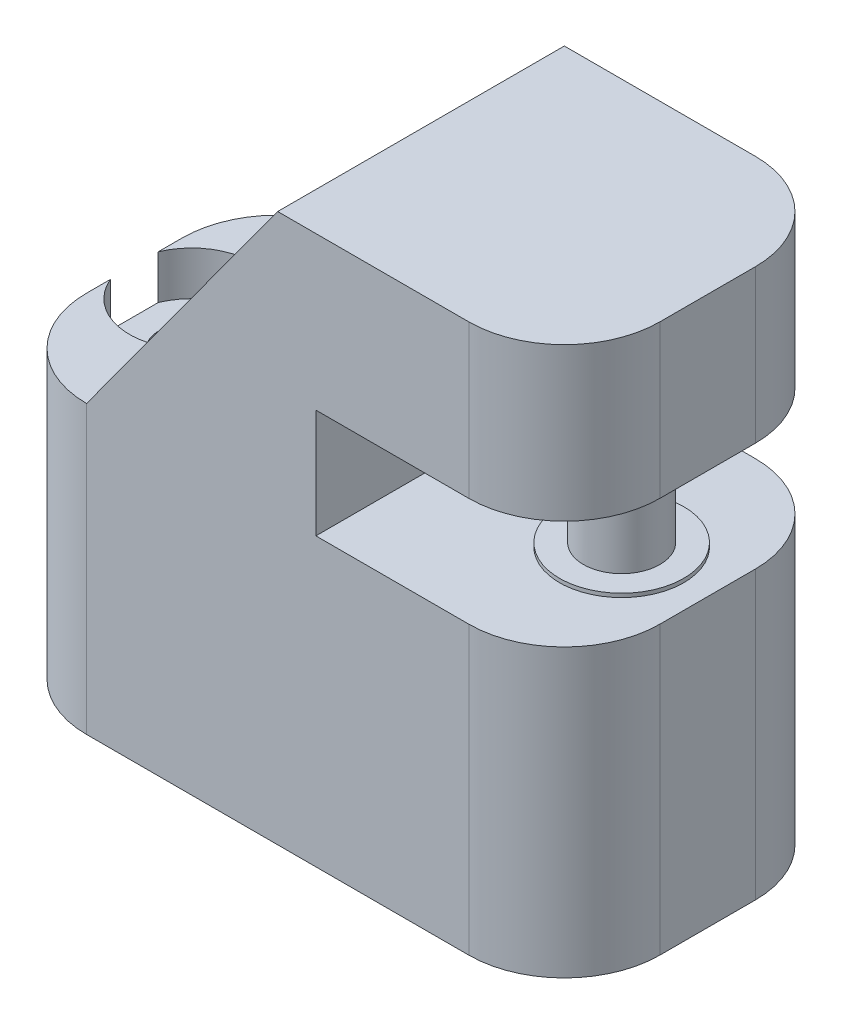
from build123d import *

# Parameters (mm, degrees)
BOSS_EXTRUDE1_DEPTH           = 15
BOSS_EXTRUDE2_REACH           = 38.742
SKETCH3_R                     = 2
SKETCH4_R                     = 3.25
BOSS_EXTRUDE3_DEPTH           = 0.2
FILLET1_R                     = 5
CBORE_FOR_M3_SHCS1_AT_2_COUNT = 2
CBORE_FOR_M3_SHCS1_AT_2_PITCH = 7


with BuildPart() as part:
    # Sketch1 → Boss-Extrude1 (new body)
    with BuildSketch(Plane.XY):
        Polygon((0, 0), (0, 15), (5, 15), (15, 28.7), (30, 28.7), (30, 20.7), (17, 20.7), (17, 15), (30, 15), (30, 0), align=None)
    extrude(amount=BOSS_EXTRUDE1_DEPTH)

    # Sketch3 → Boss-Extrude2 (add, up to next)
    with BuildSketch(Plane(origin=(0, 15, 0), x_dir=(1, 0, 0), z_dir=(0, 1, 0)), mode=Mode.PRIVATE) as boss_extrude2_sk1:
        with Locations((25.5, -7.5)):
            Circle(SKETCH3_R)
    boss_extrude2_tool1 = extrude(boss_extrude2_sk1.sketch, amount=BOSS_EXTRUDE2_REACH, mode=Mode.PRIVATE) - part.part
    add(boss_extrude2_tool1.solids().sort_by_distance((25.5, 15, 7.5))[0])

    # Sketch4 → Boss-Extrude3 (add)
    with BuildSketch(Plane(origin=(0, 15, 0), x_dir=(1, 0, 0), z_dir=(0, 1, 0))):
        with Locations((25.5, -7.5)):
            Circle(SKETCH4_R)
    boss_extrude3 = extrude(amount=BOSS_EXTRUDE3_DEPTH)

    # Mirror1: Boss-Extrude3 across plane
    add(boss_extrude3.mirror(Plane.ZX.offset(17.85)))

    # Fillet1
    fillet1_edges = [part.edges().sort_by_distance(p)[0] for p in [
        (30, 24.7, 0),
        (30, 24.7, 15),
        (30, 7.5, 0),
        (30, 7.5, 15),
        (0, 7.5, 0),
        (0, 7.5, 15),
    ]]
    fillet(fillet1_edges, radius=FILLET1_R)

    # Sketch6 → CBORE for M3 SHCS1 (revolve, cut)
    with BuildSketch(Plane(origin=(3, 28.7, 7.5), x_dir=(0, 0, 1), z_dir=(1, 0, 0))):
        Polygon((0, 0), (0, 28.7), (1.7, 28.7), (1.7, 16), (3.25, 16), (3.25, 0.025), (3.275, 0), align=None)
    cbore_for_m3_shcs1 = revolve(axis=Axis((3, 35.05, 7.5), (0, -1, 0)), mode=Mode.SUBTRACT)

    # CBORE for M3 SHCS1 at 2: CBORE for M3 SHCS1 ×2
    with Locations(*[(i * CBORE_FOR_M3_SHCS1_AT_2_PITCH, 0, 0) for i in range(1, CBORE_FOR_M3_SHCS1_AT_2_COUNT)]):
        add(cbore_for_m3_shcs1, mode=Mode.SUBTRACT)


solid = part.part
